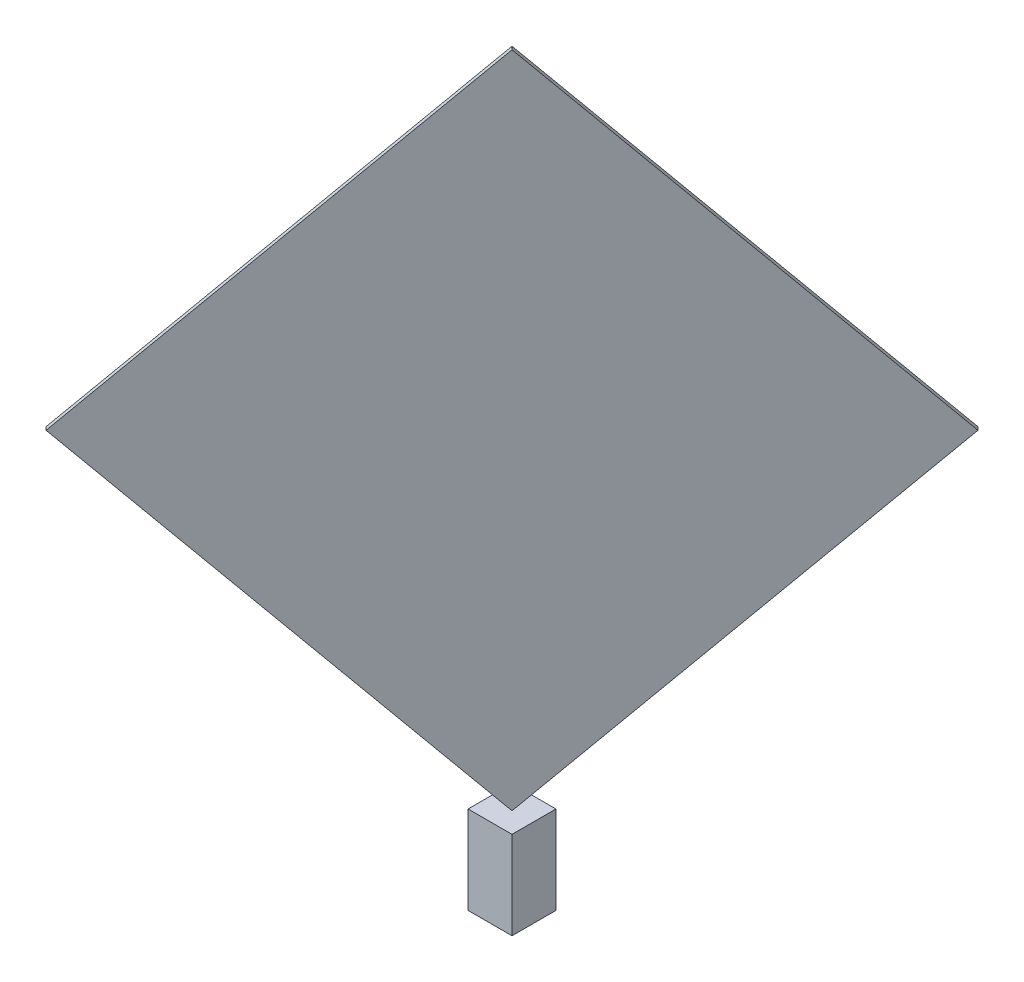
from build123d import *

# Parameters (mm, degrees)
SKETCH1_W                = 100
SKETCH1_H                = 100
BOSS_EXTRUDE1_DEPTH      = 200
BOSS_EXTRUDE2_DEPTH      = 5
BOSS_EXTRUDE2_DEPTH_BACK = 5


with BuildPart() as part:
    # Sketch1 → Boss-Extrude1 (new body)
    with BuildSketch(Plane(origin=(0, 0, 0), x_dir=(1, 0, 0), z_dir=(0, 1, 0))):
        with Locations((-1.807228916, 28.313253012)):
            Rectangle(SKETCH1_W, SKETCH1_H)
    extrude(amount=BOSS_EXTRUDE1_DEPTH)


with BuildPart() as body_2:
    # Sketch2 → Boss-Extrude2 (new, two sides: drawn at the far end of the back side and taken through both)
    with BuildSketch(Plane(origin=(-15.060240964, 0, -15.060240964), x_dir=(-0.7071067811865475, 0, 0.7071067811865477), z_dir=(-0.7071067811865477, 0, -0.7071067811865475)).offset(-BOSS_EXTRUDE2_DEPTH_BACK)):
        Polygon((-18.742589381, 200), (731.257410619, 950), (-18.742589381, 1700), (-768.742589381, 950), align=None)
    extrude(amount=BOSS_EXTRUDE2_DEPTH + BOSS_EXTRUDE2_DEPTH_BACK)


solid = Compound([part.part, body_2.part])
